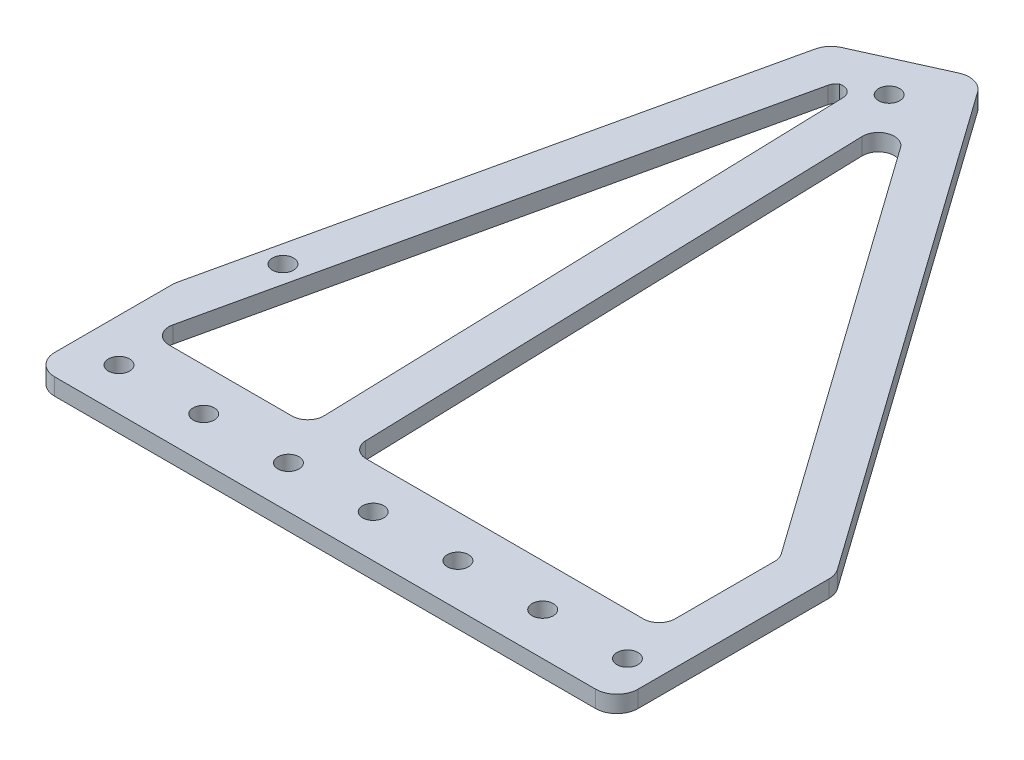
from build123d import *

# Parameters (mm, degrees)
SKETCH1_R           = 2
BOSS_EXTRUDE1_DEPTH = 3.18
FILLET2_R           = 4
FILLET4_R           = 3
FILLET5_R           = 2


with BuildPart() as part:
    # Sketch1 → Boss-Extrude1 (new body)
    with BuildSketch(Plane(origin=(0, 0, 0), x_dir=(1, 0, 0), z_dir=(0, 1, 0))):
        Polygon((-16, -8), (6, -8), (6, 33.34843691), (-61.475760907, 128.370940703), (-81.524239093, 119.312324779), (-104.126855641, 18.58956294), (-104.126855641, -8), (-86.093666761, -8), align=None)
        with Locations(Location((-16, 0, 0), (0, 0, 90))):
            Circle(SKETCH1_R, mode=Mode.SUBTRACT)
        with Locations(Location((0, 0, 0), (0, 0, 90))):
            Circle(SKETCH1_R, mode=Mode.SUBTRACT)
        with Locations(Location((-67.5, 116.913429511, 0), (0, 0, 90))):
            Circle(SKETCH1_R, mode=Mode.SUBTRACT)
        with Locations(Location((-32, 0, 0), (0, 0, 90))):
            Circle(SKETCH1_R, mode=Mode.SUBTRACT)
        with Locations(Location((-48, 0, 0), (0, 0, 90))):
            Circle(SKETCH1_R, mode=Mode.SUBTRACT)
        with Locations(Location((-64, 0, 0), (0, 0, 90))):
            Circle(SKETCH1_R, mode=Mode.SUBTRACT)
        with Locations(Location((-80, 0, 0), (0, 0, 90))):
            Circle(SKETCH1_R, mode=Mode.SUBTRACT)
        with Locations(Location((-96, 0, 0), (0, 0, 90))):
            Circle(SKETCH1_R, mode=Mode.SUBTRACT)
        with Locations(Location((-97.021679837, 31.983686003, 0), (0, 0, 90))):
            Circle(SKETCH1_R, mode=Mode.SUBTRACT)
        Polygon((-63.513465031, 117.423073167), (-2, 30.796951643), (-2, 8), (-60.237701437, 8), align=None, mode=Mode.SUBTRACT)
        Polygon((-68.241285453, 8), (-98.304243511, 8), (-74.592422981, 113.66564481), (-71.44710907, 115.086809569), align=None, mode=Mode.SUBTRACT)
    extrude(amount=BOSS_EXTRUDE1_DEPTH)

    # Fillet2
    fillet2_edges = [part.edges().sort_by_distance(p)[0] for p in [
        (6, 1.59, 8),
        (-104.126855641, 1.59, 8),
        (-104.126855641, 1.59, -18.58956294),
        (-81.524239093, 1.59, -119.312324779),
        (-61.475760907, 1.59, -128.370940703),
        (6, 1.59, -33.34843691),
    ]]
    fillet(fillet2_edges, radius=FILLET2_R)

    # Fillet4
    fillet4_edges = [part.edges().sort_by_distance(p)[0] for p in [
        (-98.304243511, 1.59, -8),
        (-68.241285453, 1.59, -8),
        (-63.513465031, 1.59, -117.423073167),
        (-60.237701437, 1.59, -8),
        (-2, 1.59, -8),
        (-2, 1.59, -30.796951643),
    ]]
    fillet(fillet4_edges, radius=FILLET4_R)

    # Fillet5
    # the kernel refuses this fillet: 2 mm, written as the material it adds along each edge
    with BuildSketch(Plane(origin=(-71.44710907, 0, -115.086809569), x_dir=(0.02992327493551802, 0, 0.9995521985454954), z_dir=(0, 1, 0))) as fillet5_piece_1:
        with BuildLine():
            CenterArc((FILLET5_R * 1.49944843897, -FILLET5_R), FILLET5_R, 90, 112.600412538)
            Line((FILLET5_R * 0.576240988861, -FILLET5_R * 1.3843019699), (0, 0))
            Line((0, 0), (FILLET5_R * 1.49944843897, 0))
        make_face()
    extrude(amount=3.18)
    with BuildSketch(Plane(origin=(-74.592422981, 0, -113.66564481), x_dir=(-0.21895888286608584, 0, 0.9757340865287201), z_dir=(0, 1, 0))) as fillet5_piece_2:
        with BuildLine():
            CenterArc((FILLET5_R * 0.498984426224, FILLET5_R), FILLET5_R, 216.963036407, 53.036963593)
            Line((-FILLET5_R * 0.300039170379, FILLET5_R * 0.39870033089), (0, 0))
            Line((0, 0), (FILLET5_R * 0.498984426224, 0))
        make_face()
    extrude(amount=3.18)


solid = part.part
